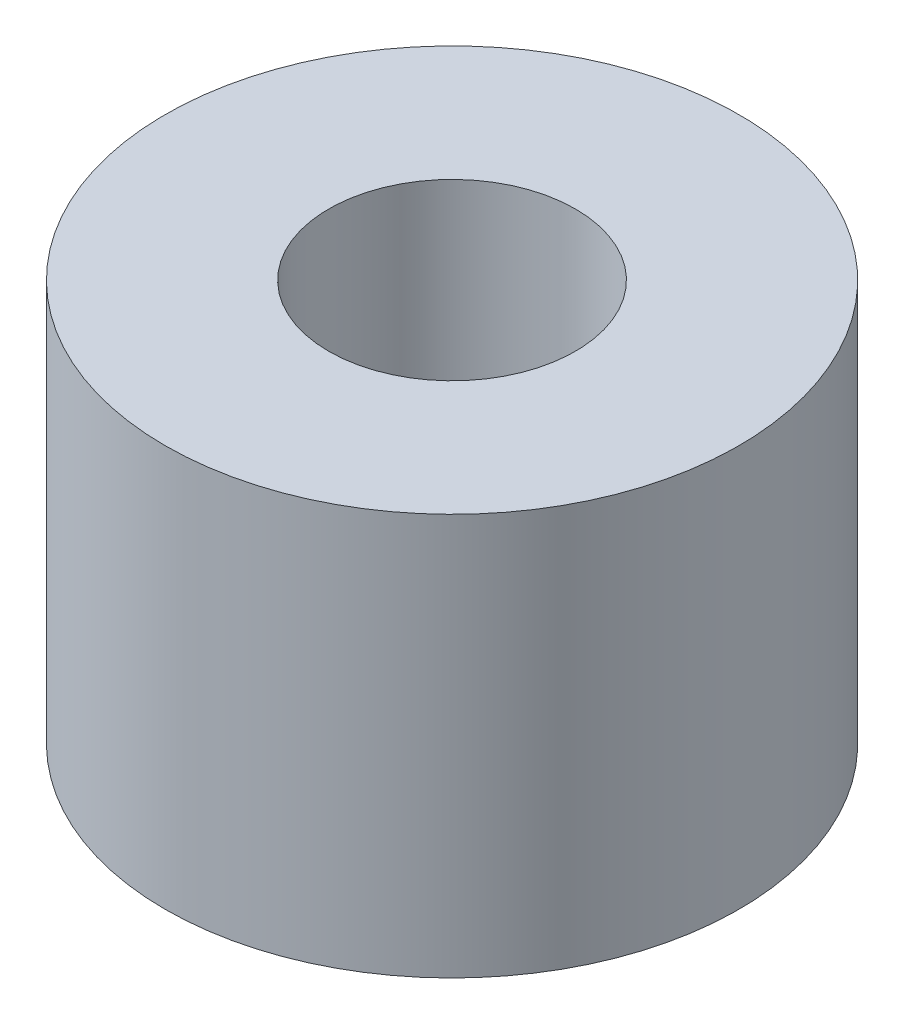
from build123d import *

# Parameters (mm, degrees)
SKETCH1_R           = 5
SKETCH1_R_2         = 2.15
BOSS_EXTRUDE1_DEPTH = 7


with BuildPart() as part:
    # Sketch1 → Boss-Extrude1 (new body)
    with BuildSketch(Plane(origin=(0, 0, 0), x_dir=(1, 0, 0), z_dir=(0, 1, 0))):
        Circle(SKETCH1_R)
        Circle(SKETCH1_R_2, mode=Mode.SUBTRACT)
    extrude(amount=BOSS_EXTRUDE1_DEPTH)


solid = part.part
